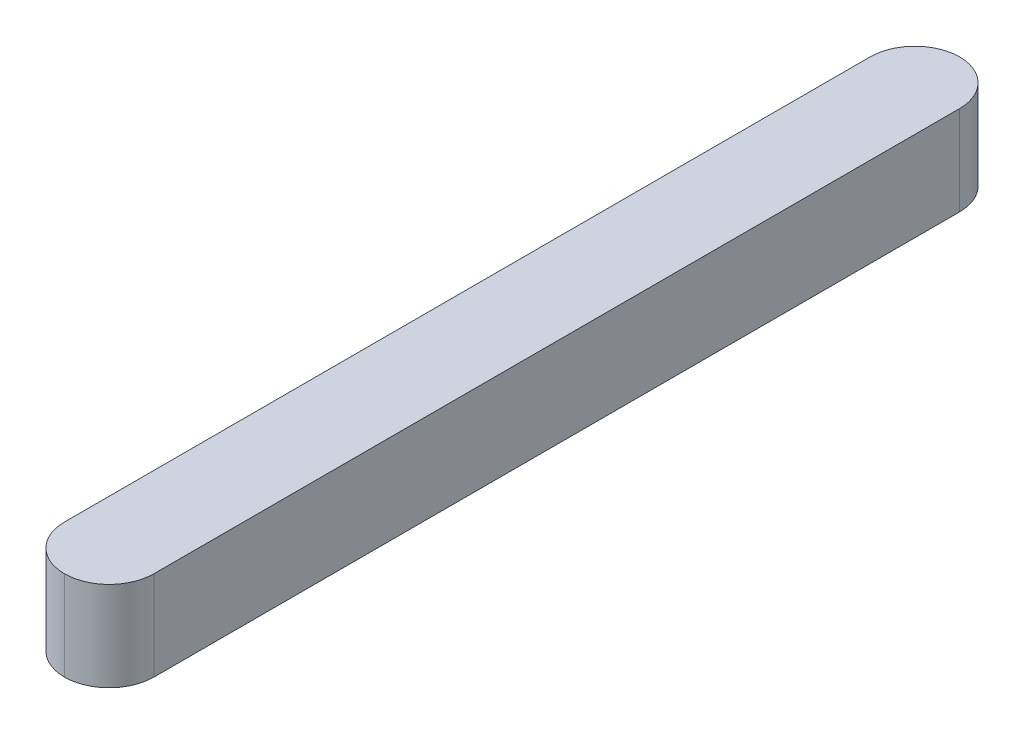
from build123d import *

# Parameters (mm, degrees)
ESQUISSE1_W          = 6
ESQUISSE1_H          = 6
BASE_EXTRUSION_DEPTH = 60
CONG_1_R             = 3


with BuildPart() as part:
    # Esquisse1 → Base-Extrusion (new body)
    with BuildSketch(Plane.XY):
        with Locations((3, 3)):
            Rectangle(ESQUISSE1_W, ESQUISSE1_H)
    extrude(amount=BASE_EXTRUSION_DEPTH)

    # Congé1
    cong_1_edges = [part.edges().sort_by_distance(p)[0] for p in [
        (6, 3, 0),
        (6, 3, 60),
        (0, 3, 0),
        (0, 3, 60),
    ]]
    fillet(cong_1_edges, radius=CONG_1_R - 0.0001)  # a hair under: the kernel refuses the full size


solid = part.part
